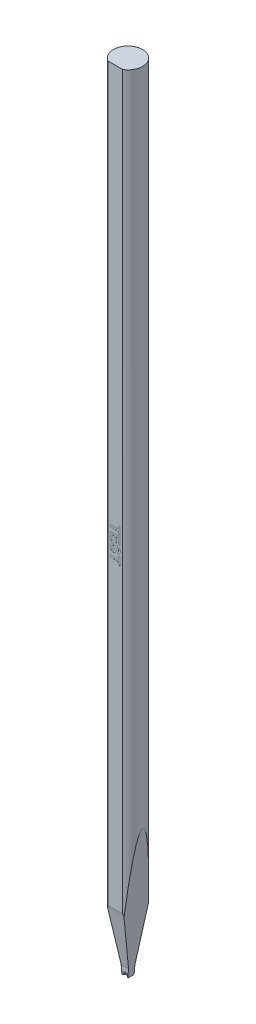
from build123d import *

# Parameters (mm, degrees)
SKETCH_TL_CUTTING_R       = 1.4986
TL_CUTTING_DEPTH          = 81.28
SKETCH_TDF_GRINDING_W     = 3.0172
SKETCH_TDF_GRINDING_H     = 3.0172
TDF_GRINDING_DEPTH        = 82.307625743
ENGRAVING_DEPTH           = 0.005
VW_VR_GRINDING_DEPTH      = 1.5086
VW_VR_GRINDING_DEPTH_BACK = 1.5086
ISA_GRINDING_DEPTH        = 1.5086
ISA_GRINDING_DEPTH_BACK   = 1.5086
PRE_FRX_BRX_DEPTH         = 1.5086
PRE_FRX_BRX_DEPTH_BACK    = 1.5086
SKETCH_PRE_FRX_BRX_W      = 1.18348
SKETCH_PRE_FRX_BRX_H      = 0.889
FR_EDM_R                  = 0.22606
BR_EDM_R                  = 0.22606
FA_BA_GRINDING_DEPTH      = 1.5086
FA_BA_GRINDING_DEPTH_BACK = 1.5086


with BuildPart() as part:
    # sketch_TL_cutting → TL_cutting (new body)
    with BuildSketch(Plane(origin=(0, 0, 0), x_dir=(1, 0, 0), z_dir=(0, 1, 0))):
        Circle(SKETCH_TL_CUTTING_R)
    extrude(amount=TL_CUTTING_DEPTH)

    # sketch_TDF_grinding → TDF_grinding (cut, through all)
    with BuildSketch(Plane(origin=(0, 0, 0), x_dir=(1, 0, 0), z_dir=(0, 1, 0))):
        with Locations((0, -2.804)):
            Rectangle(SKETCH_TDF_GRINDING_W, SKETCH_TDF_GRINDING_H)
    extrude(amount=TDF_GRINDING_DEPTH, mode=Mode.SUBTRACT)

    # sketch_engraving → engraving (cut)
    with BuildSketch(Plane.XY.offset(1.2954)):
        Polygon((-0.5, 40.306666667), (0.333333333, 40.306666667), (0.333333333, 40.601538462), (0.5, 40.601538462), (0.5, 39.819487179), (0.333333333, 39.819487179), (0.333333333, 40.114358974), (-0.5, 40.114358974), align=None)
        Polygon((-0.5, 39.691282051), (0.5, 39.691282051), (0.5, 38.947692308), (0.333333333, 38.947692308), (0.333333333, 39.498974359), (0.115384615, 39.498974359), (0.115384615, 38.986153846), (-0.051282051, 38.986153846), (-0.051282051, 39.498974359), (-0.333333333, 39.498974359), (-0.333333333, 38.934871795), (-0.5, 38.934871795), align=None)
        with BuildLine():
            Line((-0.166666667, 38.819487179), (-0.153846154, 38.627179487))
            add(Edge.make_bspline(
                [(-0.153846154, 38.627179487), (-0.161891279, 38.625646838), (-0.177518424, 38.622669765), (-0.199795017, 38.616065855), (-0.220541784, 38.608759687), (-0.239662803, 38.60014681), (-0.25710555, 38.590281742), (-0.273156714, 38.579491464), (-0.28732832, 38.567248708), (-0.299925293, 38.553917022), (-0.310783278, 38.539343845), (-0.320246275, 38.523643245), (-0.328256178, 38.506721977), (-0.334922245, 38.488644665), (-0.339885492, 38.469231253), (-0.343420115, 38.448663609), (-0.345682646, 38.426908608), (-0.345994208, 38.412040942), (-0.346153846, 38.404423077)],
                knots=[0, 0, 0, 0, 1.20477517, 2.340199137, 3.415898527, 4.440826703, 5.422227366, 6.362763262, 7.28278988, 8.172822029, 9.057410505, 9.952475558, 10.866920142, 11.809098, 12.784128911, 13.811833846, 14.878831738, 16, 16, 16, 16], degree=3))
            add(Edge.make_bspline(
                [(-0.346153846, 38.404423077), (-0.346066367, 38.396404779), (-0.345896216, 38.380808776), (-0.343785338, 38.358208443), (-0.340761278, 38.337076105), (-0.335974263, 38.317598368), (-0.330620744, 38.299411504), (-0.323296559, 38.282967199), (-0.314849171, 38.267999345), (-0.305263574, 38.254546503), (-0.294632459, 38.242806195), (-0.28353392, 38.232535187), (-0.272207737, 38.223589818), (-0.260151301, 38.21654918), (-0.247852227, 38.210851285), (-0.234943611, 38.207085376), (-0.221721863, 38.204541282), (-0.212685699, 38.204249548), (-0.208133013, 38.204102564)],
                knots=[0, 0, 0, 0, 1.417779877, 2.757654889, 4.012140507, 5.189587551, 6.302846416, 7.360586765, 8.365575446, 9.33904572, 10.275781718, 11.161696098, 12.012180333, 12.822428111, 13.625933072, 14.403138519, 15.195454004, 16, 16, 16, 16], degree=3))
            add(Edge.make_bspline(
                [(-0.208133013, 38.204102564), (-0.202439146, 38.204396842), (-0.191320796, 38.204971475), (-0.175220679, 38.208741774), (-0.160658688, 38.215546278), (-0.147071392, 38.224782817), (-0.134926522, 38.237747215), (-0.123459543, 38.25415137), (-0.11316916, 38.274611084), (-0.107424402, 38.289779688), (-0.104366987, 38.297852564)],
                knots=[0, 0, 0, 0, 0.906150226, 1.7694295, 2.610923838, 3.450874087, 4.367551936, 5.419872502, 6.626831617, 8, 8, 8, 8], degree=3))
            add(Edge.make_bspline(
                [(-0.104366987, 38.297852564), (-0.103205903, 38.301316751), (-0.100607587, 38.30906904), (-0.096897182, 38.322295), (-0.092218385, 38.338280402), (-0.087052561, 38.357173825), (-0.081545375, 38.378936731), (-0.074955523, 38.403362379), (-0.068334023, 38.430821678), (-0.063456004, 38.450034741), (-0.060897436, 38.460112179)],
                knots=[0, 0, 0, 0, 0.521824192, 1.167757792, 1.961731518, 2.901193269, 3.965386864, 5.168422915, 6.514810244, 8, 8, 8, 8], degree=3))
            add(Edge.make_bspline(
                [(-0.060897436, 38.460112179), (-0.0576208, 38.473235696), (-0.051299067, 38.498555374), (-0.040053153, 38.534667033), (-0.028879714, 38.567926531), (-0.016755933, 38.598013634), (-0.004503472, 38.625260214), (0.008737874, 38.64922555), (0.022280434, 38.670409746), (0.032402475, 38.682754268), (0.037259615, 38.688677885)],
                knots=[0, 0, 0, 0, 1.293880989, 2.496331788, 3.617634808, 4.64976062, 5.598842568, 6.473791081, 7.267636666, 8, 8, 8, 8], degree=3))
            add(Edge.make_bspline(
                [(0.037259615, 38.688677885), (0.044137694, 38.696023939), (0.057622804, 38.710426557), (0.079781426, 38.729385368), (0.103188466, 38.745315932), (0.127671148, 38.75842853), (0.153370416, 38.768524983), (0.180114252, 38.775681219), (0.207972454, 38.780312995), (0.22694455, 38.780785635), (0.236578526, 38.781025641)],
                knots=[0, 0, 0, 0, 1.064429417, 2.086912298, 3.078678339, 4.055528992, 5.020032834, 5.993708893, 6.981211098, 8, 8, 8, 8], degree=3))
            add(Edge.make_bspline(
                [(0.236578526, 38.781025641), (0.249044725, 38.780558178), (0.273773943, 38.77963087), (0.310123415, 38.771128516), (0.34519423, 38.757880126), (0.373053378, 38.742527737), (0.394102454, 38.727749212), (0.409316468, 38.715522559), (0.423234984, 38.701832745), (0.436363342, 38.687171315), (0.448421192, 38.671292179), (0.459337354, 38.654175805), (0.469762031, 38.636144051), (0.481724432, 38.609831674), (0.494501972, 38.574300806), (0.505216674, 38.528065757), (0.511620444, 38.477719983), (0.512410831, 38.442770721), (0.512820513, 38.424655449)],
                knots=[0, 0, 0, 0, 1.180224575, 2.341213254, 3.519178081, 4.726056898, 5.344182394, 5.956118988, 6.573855441, 7.192564044, 7.82049682, 8.461345463, 9.116141012, 9.79299132, 11.198532007, 12.687823846, 14.283197644, 16, 16, 16, 16], degree=3))
            add(Edge.make_bspline(
                [(0.512820513, 38.424655449), (0.512622915, 38.409822415), (0.512238592, 38.38097248), (0.508327094, 38.339154507), (0.502300976, 38.300146167), (0.493471523, 38.264011321), (0.482080613, 38.230681933), (0.468307987, 38.20009305), (0.4520288, 38.172325051), (0.433078398, 38.147673078), (0.412189308, 38.12570984), (0.389371716, 38.106550603), (0.364914548, 38.09012187), (0.338835479, 38.076317679), (0.311000478, 38.06547728), (0.281444264, 38.057515436), (0.250236407, 38.052249404), (0.228852471, 38.050929457), (0.217948718, 38.05025641)],
                knots=[0, 0, 0, 0, 1.325136797, 2.577362738, 3.74962816, 4.849499017, 5.896771726, 6.892816139, 7.842473141, 8.766187929, 9.665133525, 10.546015357, 11.42313021, 12.293255665, 13.177485873, 14.086514152, 15.024305989, 16, 16, 16, 16], degree=3))
            Line((0.217948718, 38.05025641), (0.205128205, 38.242564103))
            add(Edge.make_bspline(
                [(0.205128205, 38.242564103), (0.211158714, 38.243673027), (0.22291155, 38.245834207), (0.239739753, 38.250541314), (0.255319488, 38.255822081), (0.269550394, 38.262088391), (0.282452554, 38.269306722), (0.29405422, 38.277510903), (0.304442868, 38.286546774), (0.313348905, 38.296795242), (0.321255295, 38.308019416), (0.327770309, 38.320645904), (0.333732615, 38.33428403), (0.338229411, 38.349445002), (0.341791978, 38.365853856), (0.344434282, 38.383515385), (0.34572413, 38.402467598), (0.346007328, 38.415505964), (0.346153846, 38.422251603)],
                knots=[0, 0, 0, 0, 1.150775252, 2.242741279, 3.277646382, 4.23752694, 5.158201782, 6.048759188, 6.901533576, 7.736611693, 8.592238639, 9.472855288, 10.399741491, 11.383322377, 12.435924598, 13.551250831, 14.733094547, 16, 16, 16, 16], degree=3))
            add(Edge.make_bspline(
                [(0.346153846, 38.422251603), (0.346024502, 38.42926523), (0.345772856, 38.442910555), (0.344228543, 38.462795431), (0.34137789, 38.481448937), (0.337667048, 38.498962684), (0.332618703, 38.51531328), (0.326463073, 38.530466219), (0.319216002, 38.544490828), (0.313514257, 38.553042422), (0.310697115, 38.557267628)],
                knots=[0, 0, 0, 0, 1.186678824, 2.308736671, 3.37120409, 4.377216403, 5.334874112, 6.262130804, 7.141346615, 8, 8, 8, 8], degree=3))
            add(Edge.make_bspline(
                [(0.310697115, 38.557267628), (0.30684882, 38.562103022), (0.299395868, 38.571467679), (0.284596838, 38.581546031), (0.267881777, 38.587613222), (0.256061421, 38.588343477), (0.25, 38.588717949)],
                knots=[0, 0, 0, 0, 1.037857257, 2.010007357, 2.979541333, 4, 4, 4, 4], degree=3))
            add(Edge.make_bspline(
                [(0.25, 38.588717949), (0.244335199, 38.588411699), (0.233176443, 38.587808437), (0.217325189, 38.581723758), (0.202637862, 38.572366351), (0.194659513, 38.563623389), (0.190504808, 38.559070513)],
                knots=[0, 0, 0, 0, 0.98538058, 1.941042925, 2.927803204, 4, 4, 4, 4], degree=3))
            add(Edge.make_bspline(
                [(0.190504808, 38.559070513), (0.187808196, 38.555457219), (0.18178239, 38.547383012), (0.17412302, 38.532592664), (0.165827461, 38.514740327), (0.157717635, 38.493419009), (0.149622864, 38.468770412), (0.141170987, 38.440793037), (0.132605635, 38.409469676), (0.124310512, 38.375598747), (0.116156882, 38.341210215), (0.107242663, 38.308394186), (0.098551989, 38.277879998), (0.089442753, 38.249809137), (0.080574939, 38.224036902), (0.071467056, 38.200688486), (0.062596997, 38.179603571), (0.050400038, 38.155016221), (0.033878763, 38.127148934), (0.009862335, 38.097940873), (-0.017133698, 38.07211007), (-0.042589095, 38.054111853), (-0.064481415, 38.04174802), (-0.081932142, 38.033787016), (-0.100320809, 38.026900123), (-0.119667735, 38.021294211), (-0.140000145, 38.017231274), (-0.161162698, 38.013868957), (-0.183331155, 38.012151086), (-0.198448465, 38.011914888), (-0.206129808, 38.011794872)],
                knots=[0, 0, 0, 0, 0.511875881, 1.143829537, 1.88775736, 2.750598373, 3.734912702, 4.837306479, 6.073130119, 7.42648979, 8.801963576, 10.091065733, 11.292408984, 12.408830014, 13.446061236, 14.39066453, 15.257936293, 16.045629259, 17.510392066, 18.929669597, 20.331293837, 21.746891395, 22.460690638, 23.187651344, 23.925159671, 24.69163991, 25.474819891, 26.281170188, 27.126635539, 28, 28, 28, 28], degree=3))
            add(Edge.make_bspline(
                [(-0.206129808, 38.011794872), (-0.213213723, 38.011959898), (-0.227281693, 38.012287624), (-0.248162112, 38.01457786), (-0.268671734, 38.018119654), (-0.288836268, 38.023362726), (-0.308616053, 38.030318192), (-0.328296541, 38.03814951), (-0.347448635, 38.047942071), (-0.366087841, 38.059087568), (-0.384201522, 38.071380711), (-0.400907086, 38.085314284), (-0.416780552, 38.100055612), (-0.430830184, 38.116560723), (-0.444499814, 38.133643959), (-0.456413626, 38.152420246), (-0.467267368, 38.1722888), (-0.476944445, 38.193430724), (-0.485241283, 38.215916056), (-0.492760445, 38.239609726), (-0.498861937, 38.264735261), (-0.504102567, 38.291122199), (-0.508085093, 38.318872973), (-0.510866581, 38.347951218), (-0.512434986, 38.37836402), (-0.512690407, 38.39907945), (-0.512820513, 38.40963141)],
                knots=[0, 0, 0, 0, 0.900523777, 1.788352984, 2.667658312, 3.544829998, 4.433470602, 5.332071549, 6.235671317, 7.16456001, 8.092361829, 9.015217829, 9.927983376, 10.842405559, 11.767913001, 12.707486241, 13.664840466, 14.644960138, 15.660436429, 16.710285012, 17.80361473, 18.945755434, 20.129541241, 21.366238063, 22.658422763, 24, 24, 24, 24], degree=3))
            add(Edge.make_bspline(
                [(-0.512820513, 38.40963141), (-0.512571769, 38.424866814), (-0.512087459, 38.454530507), (-0.507752501, 38.497626527), (-0.501117535, 38.538047736), (-0.491487967, 38.575728351), (-0.47912575, 38.610714363), (-0.463898318, 38.642990034), (-0.445714308, 38.67239848), (-0.4250161, 38.699306724), (-0.401421388, 38.723346069), (-0.37543806, 38.744991703), (-0.346733609, 38.76382454), (-0.315676999, 38.780354557), (-0.28185988, 38.793843417), (-0.245840091, 38.805371406), (-0.207125792, 38.81394819), (-0.180386288, 38.817608917), (-0.166666667, 38.819487179)],
                knots=[0, 0, 0, 0, 1.217919187, 2.371317543, 3.459749122, 4.490553404, 5.476795534, 6.422548752, 7.338285933, 8.236452553, 9.131296239, 10.026155855, 10.935394819, 11.871650654, 12.834387429, 13.842485342, 14.893012909, 16, 16, 16, 16], degree=3))
        make_face()
        Polygon((-0.5, 37.614358974), (0.333333333, 37.614358974), (0.333333333, 37.909230769), (0.5, 37.909230769), (0.5, 37.127179487), (0.333333333, 37.127179487), (0.333333333, 37.422051282), (-0.5, 37.422051282), align=None)
    extrude(amount=-ENGRAVING_DEPTH, mode=Mode.SUBTRACT)

    # sketch_VW_VR_grinding → VW_VR_grinding (cut, two sides: drawn at the far end of the back side and taken through both)
    with BuildSketch(Plane.XY.offset(-VW_VR_GRINDING_DEPTH_BACK)):
        with BuildLine():
            Line((-1.4936, -0.01), (-1.4936, 0.874))
            ThreePointArc((-1.4936, 0.874), (-1.495064466, 0.877535534), (-1.4986, 0.879))
            Line((-1.4986, 0.879), (-1.5086, 0.879))
            Line((-1.5086, 0.879), (-1.5086, -0.01))
            Line((-1.5086, -0.01), (-1.4936, -0.01))
        make_face()
        with BuildLine():
            Line((1.4936, -0.01), (1.4936, 0.874))
            ThreePointArc((1.4936, 0.874), (1.495064466, 0.877535534), (1.4986, 0.879))
            Line((1.4986, 0.879), (1.5086, 0.879))
            Line((1.5086, 0.879), (1.5086, -0.01))
            Line((1.5086, -0.01), (1.4936, -0.01))
        make_face()
    extrude(amount=VW_VR_GRINDING_DEPTH + VW_VR_GRINDING_DEPTH_BACK, mode=Mode.SUBTRACT)

    # sketch_ISA_grinding → ISA_grinding (cut, two sides: drawn at the far end of the back side and taken through both)
    with BuildSketch(Plane.XY.offset(-ISA_GRINDING_DEPTH_BACK)):
        Polygon((-0.29972, 0), (-1.5086, 13.817561628), (-1.5086, -0.01), (1.5086, -0.01), (1.5086, 13.817561628), (0.29972, 0), align=None)
    extrude(amount=ISA_GRINDING_DEPTH + ISA_GRINDING_DEPTH_BACK, mode=Mode.SUBTRACT)

    # sketch_pre_FRX_BRX → pre_FRX_BRX (cut, two sides: drawn at the far end of the back side and taken through both)
    with BuildSketch(Plane(origin=(0, 0, 0), x_dir=(0, 0, -1), z_dir=(1, 0, 0)).offset(-PRE_FRX_BRX_DEPTH_BACK)):
        with Locations((-0.91686, 0.4345)):
            Rectangle(SKETCH_PRE_FRX_BRX_W, SKETCH_PRE_FRX_BRX_H)
        with Locations((0.91686, 0.4345)):
            Rectangle(SKETCH_PRE_FRX_BRX_W, SKETCH_PRE_FRX_BRX_H)
    extrude(amount=PRE_FRX_BRX_DEPTH + PRE_FRX_BRX_DEPTH_BACK, mode=Mode.SUBTRACT)

    # V-Groove_EDM: sweep along a path in sketch_contour_V-Groove
    with BuildLine(Plane(origin=(0, 0, 0), x_dir=(0, 0, -1), z_dir=(1, 0, 0))) as v_groove_edm_path:
        Line((-1.2954, 0.1905), (0, 0.1905))
        Line((0, 0.1905), (1.4986, 0.1905))
    # sketch_section_V-Groove → V-Groove_EDM (sweep, cut)
    with BuildSketch(Plane.XY.offset(1.2954)):
        with BuildLine():
            Line((-1.49899536, -1.905), (-0.049898839, 0.164524309))
            ThreePointArc((-0.049898839, 0.164524309), (0, 0.1905), (0.049898839, 0.164524309))
            Line((0.049898839, 0.164524309), (1.49899536, -1.905))
            Line((1.49899536, -1.905), (-1.49899536, -1.905))
        make_face()
    sweep(path=v_groove_edm_path.line, mode=Mode.SUBTRACT)

    # FR_EDM
    fr_edm_edges = [part.edges().sort_by_distance(p)[0] for p in [
        (0.107499419, 0.082262154, 0.32512),
        (0, 0.1905, 0.32512),
        (-0.107499419, 0.082262154, 0.32512),
    ]]
    fillet(fr_edm_edges, radius=FR_EDM_R)

    # BR_EDM
    br_edm_edges = [part.edges().sort_by_distance(p)[0] for p in [
        (0.107499419, 0.082262154, -0.32512),
        (0, 0.1905, -0.32512),
        (-0.107499419, 0.082262154, -0.32512),
    ]]
    fillet(br_edm_edges, radius=BR_EDM_R)

    # sketch_FA_BA_grinding → FA_BA_grinding (cut, two sides: drawn at the far end of the back side and taken through both)
    with BuildSketch(Plane(origin=(0, 0, 0), x_dir=(0, 0, -1), z_dir=(1, 0, 0)).offset(-FA_BA_GRINDING_DEPTH_BACK)):
        Polygon((2.4986, 13.215417609), (2.4986, -0.1), (0.32512, -0.1), (0.32512, 0.889), align=None)
        Polygon((-4.003016323, 21.747386554), (-0.32512, 0.889), (-0.32512, -0.1), (-4.003016323, -0.1), align=None)
    extrude(amount=FA_BA_GRINDING_DEPTH + FA_BA_GRINDING_DEPTH_BACK, mode=Mode.SUBTRACT)


solid = part.part
